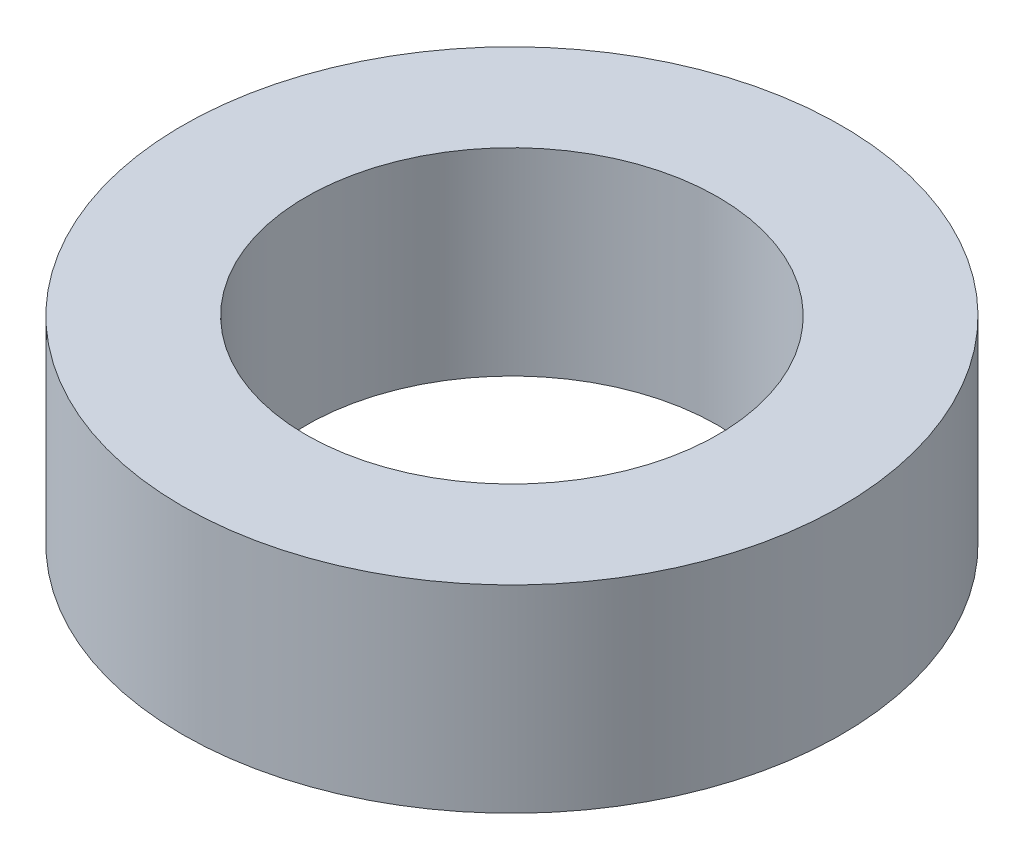
from build123d import *

# Parameters (mm, degrees)
SKETCH1_R           = 20
BOSS_EXTRUDE1_DEPTH = 12
SKETCH2_R           = 12.5
CUT_EXTRUDE1_DEPTH  = 31.724582991


with BuildPart() as part:
    # Sketch1 → Boss-Extrude1 (new body)
    with BuildSketch(Plane(origin=(0, 0, 0), x_dir=(1, 0, 0), z_dir=(0, 1, 0))):
        Circle(SKETCH1_R)
    extrude(amount=BOSS_EXTRUDE1_DEPTH)

    # Sketch2 → Cut-Extrude1 (cut, through all)
    with BuildSketch(Plane(origin=(0, 0, 0), x_dir=(1, 0, 0), z_dir=(0, 1, 0))):
        Circle(SKETCH2_R)
    extrude(amount=CUT_EXTRUDE1_DEPTH, mode=Mode.SUBTRACT)


solid = part.part
